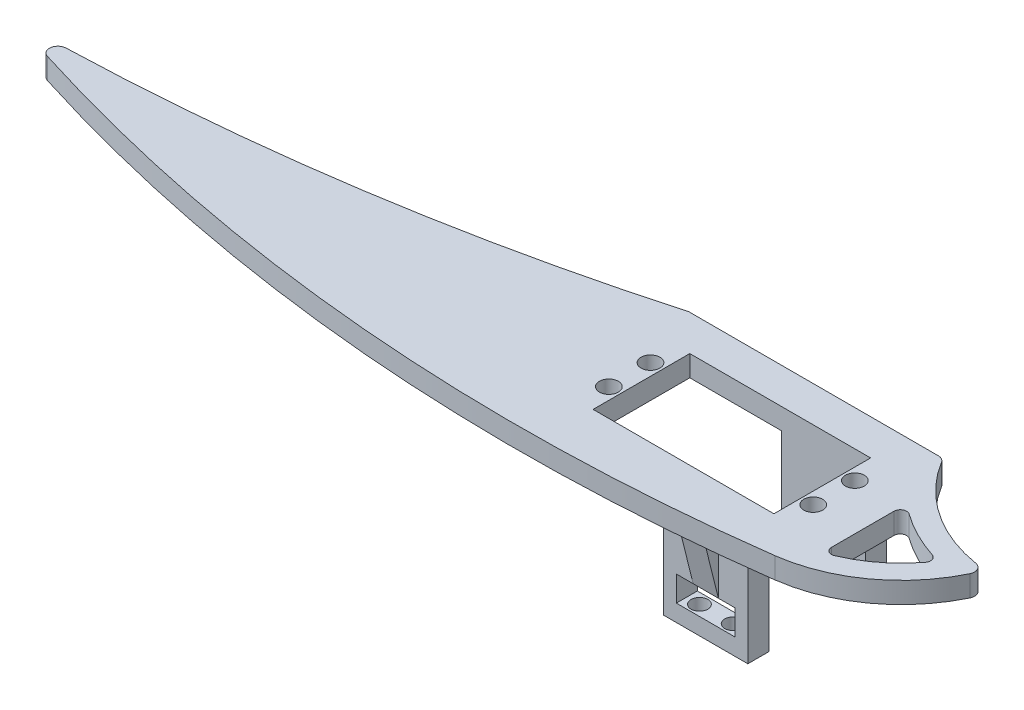
from build123d import *

# Parameters (mm, degrees)
SKETCH1_W           = 60.5
SKETCH1_H           = 40
SKETCH1_W_2         = 43
SKETCH1_H_2         = 23
BOSS_EXTRUDE1_DEPTH = 2.5
BOSS_EXTRUDE2_DEPTH = 5
BOSS_EXTRUDE3_DEPTH = 5
SKETCH4_R           = 2.25
CUT_EXTRUDE1_DEPTH  = 172.982842356
BOSS_EXTRUDE4_START = -29
SKETCH6_W           = 20
SKETCH6_H           = 5
BOSS_EXTRUDE4_DEPTH = 24
SKETCH7_W           = 14
SKETCH7_H           = 6
CUT_EXTRUDE3_DEPTH  = 177.123713622
FILLET1_R           = 2
FILLET2_R           = 2
FILLET3_R           = 1.5
CUT_EXTRUDE4_REACH  = 166.861
SKETCH8_R           = 2
BOSS_EXTRUDE5_DEPTH = 3
FILLET4_R           = 2


with BuildPart() as part:
    # Sketch1 → Boss-Extrude1 (new, symmetric)
    with BuildSketch(Plane(origin=(0, 0, 0), x_dir=(1, 0, 0), z_dir=(0, 1, 0))):
        Rectangle(SKETCH1_W, SKETCH1_H)
        Rectangle(SKETCH1_W_2, SKETCH1_H_2, mode=Mode.SUBTRACT)
    extrude(amount=BOSS_EXTRUDE1_DEPTH, both=True)

    # Sketch2 → Boss-Extrude2 (add)
    with BuildSketch(Plane(origin=(0, 2.5, 0), x_dir=(1, 0, 0), z_dir=(0, 1, 0))):
        with BuildLine():
            Line((30.25, 20), (30.25, -20))
            ThreePointArc((30.25, -20), (47.256913802, -12.826981202), (58.25, 2))
            ThreePointArc((58.25, 2), (42.044671251, 7.569488613), (30.25, 20))
        make_face()
        with BuildLine():
            Line((35.25, 6.366833624), (35.25, -13.722672005))
            ThreePointArc((35.25, -13.722672005), (44.009484688, -9.018930074), (50.750559549, -1.710601274))
            ThreePointArc((50.750559549, -1.710601274), (42.564834707, 1.49249914), (35.25, 6.366833624))
        make_face(mode=Mode.SUBTRACT)
    extrude(amount=-BOSS_EXTRUDE2_DEPTH)

    # Sketch3 → Boss-Extrude3 (add)
    with BuildSketch(Plane(origin=(0, 2.5, 0), x_dir=(1, 0, 0), z_dir=(0, 1, 0))):
        with BuildLine():
            Line((-30.25, 20), (-30.25, -20))
            Line((-30.25, -20), (30.25, -20))
            ThreePointArc((30.25, -20), (-71.163797142, -21.66706635), (-170.25, 0))
            ThreePointArc((-170.25, 0), (-99.592440555, 5.397083884), (-30.25, 20))
        make_face()
    extrude(amount=-BOSS_EXTRUDE3_DEPTH)

    # Sketch4 → Cut-Extrude1 (cut, through all)
    with BuildSketch(Plane(origin=(0, 2.5, 0), x_dir=(1, 0, 0), z_dir=(0, 1, 0))):
        with Locations(Location((-24.3, 4.95, 0), (0, 0, 270))):
            Circle(SKETCH4_R)
        with Locations(Location((-24.3, -4.95, 0), (0, 0, 270))):
            Circle(SKETCH4_R)
        with Locations(Location((24.3, -4.95, 0), (0, 0, 90))):
            Circle(SKETCH4_R)
        with Locations(Location((24.3, 4.95, 0), (0, 0, 90))):
            Circle(SKETCH4_R)
    extrude(amount=-CUT_EXTRUDE1_DEPTH, mode=Mode.SUBTRACT)

    # Sketch6 → Boss-Extrude4 (add)
    with BuildSketch(Plane(origin=(0, 2.5, 0), x_dir=(1, 0, 0), z_dir=(0, 1, 0)).offset(BOSS_EXTRUDE4_START)):
        with Locations((10.3, 14)):
            Rectangle(SKETCH6_W, SKETCH6_H)
        with Locations((10.3, -14)):
            Rectangle(SKETCH6_W, SKETCH6_H)
    extrude(amount=BOSS_EXTRUDE4_DEPTH)

    # Sketch7 → Cut-Extrude3 (cut, through all)
    with BuildSketch(Plane.XY.offset(16.5)):
        with Locations((10.3, -19.5)):
            Rectangle(SKETCH7_W, SKETCH7_H)
    extrude(amount=-CUT_EXTRUDE3_DEPTH, mode=Mode.SUBTRACT)

    # Fillet1
    fillet1_edges = [part.edges().sort_by_distance(p)[0] for p in [
        (-170.25, 0, 0),
    ]]
    fillet(fillet1_edges, radius=FILLET1_R)

    # Fillet2
    fillet2_edges = [part.edges().sort_by_distance(p)[0] for p in [
        (58.25, 0, -2),
        (30.25, 0, -20),
    ]]
    fillet(fillet2_edges, radius=FILLET2_R)

    # Fillet3
    fillet3_edges = [part.edges().sort_by_distance(p)[0] for p in [
        (35.25, 0, -6.366833624),
        (35.25, 0, 13.722672005),
        (50.750559549, 0, 1.710601274),
    ]]
    fillet(fillet3_edges, radius=FILLET3_R)

    # Sketch8 → Cut-Extrude4 (cut, up to next)
    with BuildSketch(Plane.XZ.offset(26.5), mode=Mode.PRIVATE) as cut_extrude4_sk1:
        with Locations(Location((6.3, 14, 0), (0, 0, 270))):
            Circle(SKETCH8_R)
    cut_extrude4_tool1 = extrude(cut_extrude4_sk1.sketch, amount=-CUT_EXTRUDE4_REACH, mode=Mode.PRIVATE) & part.part
    # Sketch8 → Cut-Extrude4 (cut, up to next)
    with BuildSketch(Plane.XZ.offset(26.5), mode=Mode.PRIVATE) as cut_extrude4_sk2:
        with Locations(Location((14.3, 14, 0), (0, 0, 270))):
            Circle(SKETCH8_R)
    cut_extrude4_tool2 = extrude(cut_extrude4_sk2.sketch, amount=-CUT_EXTRUDE4_REACH, mode=Mode.PRIVATE) & part.part
    cut_extrude4_1 = cut_extrude4_tool1.solids().sort_by_distance((6.3, -26.5, 14))[0]
    add(cut_extrude4_1, mode=Mode.SUBTRACT)
    cut_extrude4_2 = cut_extrude4_tool2.solids().sort_by_distance((14.3, -26.5, 14))[0]
    add(cut_extrude4_2, mode=Mode.SUBTRACT)
    cut_extrude4 = cut_extrude4_1 + cut_extrude4_2  # Cut-Extrude4 as one shape, for the pattern or mirror that repeats it

    # Sketch9 → Boss-Extrude5 (add, symmetric)
    with BuildSketch(Plane(origin=(10.3, 0, 0), x_dir=(0, 0, -1), z_dir=(1, 0, 0))):
        Polygon((-20, -2.5), (-16.5, -16.5), (-16.5, -2.5), align=None)
    boss_extrude5 = extrude(amount=BOSS_EXTRUDE5_DEPTH, both=True)

    # Mirror1: Cut-Extrude4, Boss-Extrude5 across plane
    add(cut_extrude4.mirror(Plane.XY), mode=Mode.SUBTRACT)
    add(boss_extrude5.mirror(Plane.XY))

    # Fillet4
    # the kernel refuses this fillet: 2 mm, written as the material it adds along each edge
    with BuildSketch(Plane(origin=(20.3, -2.5, 16.5), x_dir=(0, 0, 1), z_dir=(-1, 0, 0)), Plane(origin=(0.3, -2.5, -16.5), x_dir=(0, 0, -1), z_dir=(1, 0, 0)), Plane(origin=(8.3, -2.5, -16.5), x_dir=(0, 0, -1), z_dir=(1, 0, 0)), Plane(origin=(12.3, -2.5, 16.5), x_dir=(0, 0, 1), z_dir=(-1, 0, 0))) as fillet4_piece_1:
        with BuildLine():
            CenterArc((FILLET4_R, -FILLET4_R), FILLET4_R, 90, 90)
            Line((0, -FILLET4_R), (0, 0))
            Line((0, 0), (FILLET4_R, 0))
        make_face()
    extrude(amount=12)
    with BuildSketch(Plane(origin=(7.3, -2.5, 11.5), x_dir=(-1, 0, 0), z_dir=(0, 0, 1))) as fillet4_piece_2_section:
        with BuildLine():
            CenterArc((FILLET4_R, FILLET4_R), FILLET4_R, 180, 90)
            Line((0, FILLET4_R), (0, 0))
            Line((0, 0), (FILLET4_R, 0))
        make_face()
    fillet4_piece_2 = extrude(amount=13.5, mode=Mode.PRIVATE)
    fillet4_piece_2 = split(fillet4_piece_2, bisect_by=Plane(origin=(6.847209771, -4.337920215, 19.540519946), z_dir=(0, 0.242535625036333, -0.9701425001453319)), keep=Keep.TOP, mode=Mode.PRIVATE)
    add(fillet4_piece_2)
    with BuildSketch(Plane(origin=(13.3, -2.5, 20), x_dir=(0, 0, 1), z_dir=(-1, 0, 0))) as fillet4_piece_3:
        with BuildLine():
            CenterArc((FILLET4_R * 0.780776406404, -FILLET4_R), FILLET4_R, 90, 75.963756532)
            Line((-FILLET4_R * 0.189366093741, -FILLET4_R * 0.757464374964), (0, 0))
            Line((0, 0), (FILLET4_R * 0.780776406404, 0))
        make_face()
    extrude(amount=6)
    with BuildSketch(Plane(origin=(13.3, -2.5, 11.5), x_dir=(1, 0, 0), z_dir=(0, 0, 1))) as fillet4_piece_4_section:
        with BuildLine():
            CenterArc((FILLET4_R, -FILLET4_R), FILLET4_R, 90, 90)
            Line((0, -FILLET4_R), (0, 0))
            Line((0, 0), (FILLET4_R, 0))
        make_face()
    fillet4_piece_4 = extrude(amount=13.5, mode=Mode.PRIVATE)
    fillet4_piece_4 = split(fillet4_piece_4, bisect_by=Plane(origin=(13.752790229, -4.337920215, 19.540519946), z_dir=(0, 0.242535625036333, -0.9701425001453319)), keep=Keep.TOP, mode=Mode.PRIVATE)
    add(fillet4_piece_4)
    with BuildSketch(Plane(origin=(13.3, -2.5, -11.5), x_dir=(1, 0, 0), z_dir=(0, 0, -1))) as fillet4_piece_5_section:
        with BuildLine():
            CenterArc((FILLET4_R, FILLET4_R), FILLET4_R, 180, 90)
            Line((0, FILLET4_R), (0, 0))
            Line((0, 0), (FILLET4_R, 0))
        make_face()
    fillet4_piece_5 = extrude(amount=8.5, mode=Mode.PRIVATE)
    fillet4_piece_5 = split(fillet4_piece_5, bisect_by=Plane(origin=(13.752790229, -4.337920215, -19.540519946), z_dir=(0, 0.242535625036333, 0.9701425001453319)), keep=Keep.TOP, mode=Mode.PRIVATE)
    add(fillet4_piece_5)
    with BuildSketch(Plane(origin=(7.3, -2.5, -11.5), x_dir=(-1, 0, 0), z_dir=(0, 0, -1))) as fillet4_piece_6_section:
        with BuildLine():
            CenterArc((FILLET4_R, -FILLET4_R), FILLET4_R, 90, 90)
            Line((0, -FILLET4_R), (0, 0))
            Line((0, 0), (FILLET4_R, 0))
        make_face()
    fillet4_piece_6 = extrude(amount=8.5, mode=Mode.PRIVATE)
    fillet4_piece_6 = split(fillet4_piece_6, bisect_by=Plane(origin=(6.847209771, -4.337920215, -19.540519946), z_dir=(0, 0.242535625036333, 0.9701425001453319)), keep=Keep.TOP, mode=Mode.PRIVATE)
    add(fillet4_piece_6)
    with BuildSketch(Plane(origin=(13.3, -2.5, 20), x_dir=(0, 0, 1), z_dir=(-1, 0, 0))) as fillet4_piece_7a_section:
        with BuildLine():
            CenterArc((FILLET4_R * 0.780776406404, -FILLET4_R), FILLET4_R, 90, 75.963756532)
            Line((-FILLET4_R * 0.189366093741, -FILLET4_R * 0.757464374964), (0, 0))
            Line((0, 0), (FILLET4_R * 0.780776406404, 0))
        make_face()
    fillet4_piece_7a = extrude(amount=9.903882032, mode=Mode.PRIVATE)
    fillet4_piece_7a = split(fillet4_piece_7a, bisect_by=Plane(origin=(7.3, -2.834860191, 20.261450936), z_dir=(-1, 0, 0)), keep=Keep.TOP, mode=Mode.PRIVATE)
    with BuildSketch(Plane(origin=(7.3, -2.5, 16.5), x_dir=(-1, 0, 0), z_dir=(0, 0, 1))) as fillet4_piece_7b_section:
        with BuildLine():
            CenterArc((FILLET4_R, FILLET4_R), FILLET4_R, 180, 90)
            Line((0, FILLET4_R), (0, 0))
            Line((0, 0), (FILLET4_R, 0))
        make_face()
    fillet4_piece_7b = extrude(amount=8.5, mode=Mode.PRIVATE)
    fillet4_piece_7b = fillet4_piece_7b & Plane(origin=(-27.619084703, -2.967404811, -414.868675855), x_dir=(0.1319097290212544, 0, 0.9912617330400378), z_dir=(0, 1, 0)) * Cylinder(438.702172555, 25, mode=Mode.PRIVATE)
    fillet4_piece_7b = split(fillet4_piece_7b, bisect_by=Plane(origin=(6.852193926, -2.662257848, 19.959435538), z_dir=(0, -0.242535625036333, 0.9701425001453319)), keep=Keep.TOP, mode=Mode.PRIVATE)
    fillet4_piece_7 = fillet4_piece_7a & fillet4_piece_7b
    add(fillet4_piece_7)
    with BuildSketch(Plane(origin=(13.3, -2.5, 16.5), x_dir=(1, 0, 0), z_dir=(0, 0, 1))) as fillet4_piece_8a_section:
        with BuildLine():
            CenterArc((FILLET4_R, -FILLET4_R), FILLET4_R, 90, 90)
            Line((0, -FILLET4_R), (0, 0))
            Line((0, 0), (FILLET4_R, 0))
        make_face()
    fillet4_piece_8a = extrude(amount=8.5, mode=Mode.PRIVATE)
    fillet4_piece_8a = fillet4_piece_8a & Plane(origin=(-27.619084703, -2.981369523, -414.868675855), x_dir=(0.1319097290212544, 0, 0.9912617330400378), z_dir=(0, 1, 0)) * Cylinder(438.702172555, 25, mode=Mode.PRIVATE)
    fillet4_piece_8a = split(fillet4_piece_8a, bisect_by=Plane(origin=(13.730097047, -2.74600268, 19.93849933), z_dir=(0, -0.242535625036333, 0.9701425001453319)), keep=Keep.TOP, mode=Mode.PRIVATE)
    with BuildSketch(Plane(origin=(17.203882032, -2.5, 20), x_dir=(0, 0, 1), z_dir=(-1, 0, 0))) as fillet4_piece_8b_section:
        with BuildLine():
            CenterArc((FILLET4_R * 0.780776406404, -FILLET4_R), FILLET4_R, 90, 75.963756532)
            Line((-FILLET4_R * 0.189366093741, -FILLET4_R * 0.757464374964), (0, 0))
            Line((0, 0), (FILLET4_R * 0.780776406404, 0))
        make_face()
    fillet4_piece_8b = extrude(amount=9.903882032, mode=Mode.PRIVATE)
    fillet4_piece_8b = fillet4_piece_8b & Plane(origin=(-27.619084703, -2.834877125, -414.868675855), x_dir=(0.1319097290212544, 0, 0.9912617330400378), z_dir=(0, 1, 0)) * Cylinder(438.702172555, 27, mode=Mode.PRIVATE)
    fillet4_piece_8b = split(fillet4_piece_8b, bisect_by=Plane(origin=(13.3, -2.834877125, 20.261389272), z_dir=(1, 0, 0)), keep=Keep.TOP, mode=Mode.PRIVATE)
    fillet4_piece_8 = fillet4_piece_8a & fillet4_piece_8b
    add(fillet4_piece_8)


solid = part.part
